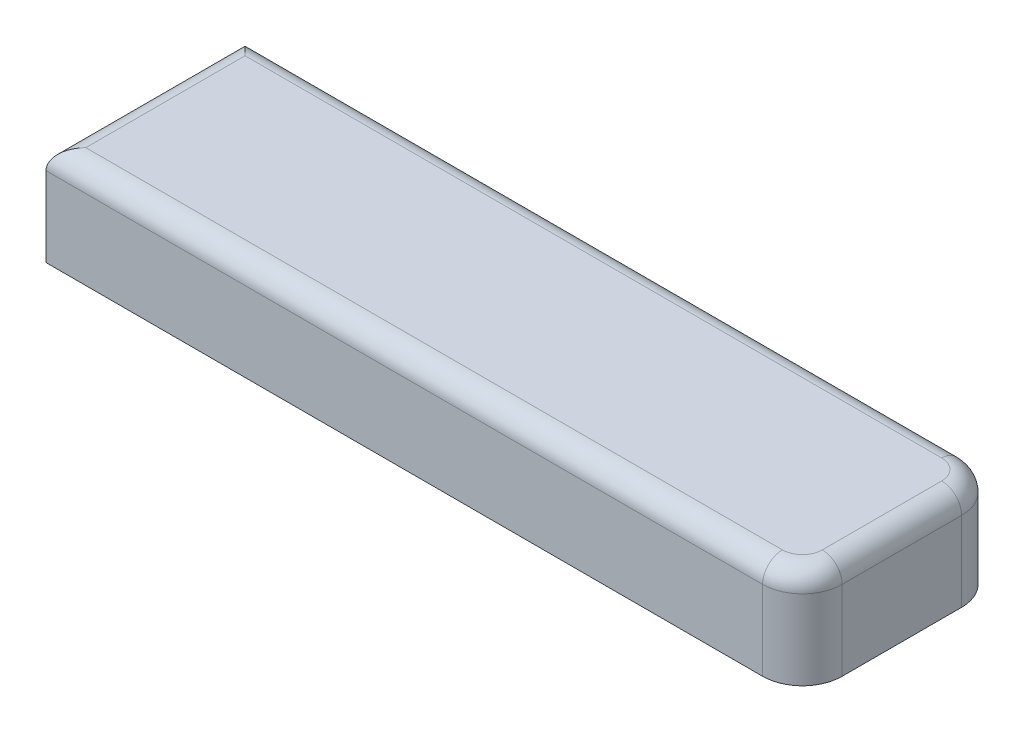
from build123d import *

# Parameters (mm, degrees)
SCHIZZO1_W                   = 38
SCHIZZO1_H                   = 5
ESTRUSIONE_ESTRUSIONE1_DEPTH = 10
RACCORDO1_R                  = 1
RACCORDO2_R                  = 2


with BuildPart() as part:
    # Schizzo1 → Estrusione-Estrusione1 (new body)
    with BuildSketch(Plane.XY):
        with Locations((19, -2.5)):
            Rectangle(SCHIZZO1_W, SCHIZZO1_H)
    extrude(amount=ESTRUSIONE_ESTRUSIONE1_DEPTH)

    # Raccordo1
    raccordo1_edges = [part.edges().sort_by_distance(p)[0] for p in [
        (19, 0, 10),
        (19, 0, 0),
        (0, 0, 5),
        (38, 0, 5),
    ]]
    fillet(raccordo1_edges, radius=RACCORDO1_R)

    # Raccordo2
    # the kernel refuses this fillet: 2 mm, written as the material it takes off along each edge
    with BuildSketch(Plane(origin=(36, 0, 8), x_dir=(0, 0, 1), z_dir=(-1, 0, 0))) as raccordo2_piece_1:
        with BuildLine():
            CenterArc((1, -1), 1, 0, 90)
            Line((2, -1), (2, 0))
            Line((2, 0), (1, 0))
        make_face()
    revolve(axis=Axis((36, 0, 8), (0, 1, 0)), revolution_arc=90, mode=Mode.SUBTRACT)
    with BuildSketch(Plane(origin=(36, 0, 2), x_dir=(1, 0, 0), z_dir=(0, 0, 1))) as raccordo2_piece_2:
        with BuildLine():
            CenterArc((1, -1), 1, 0, 90)
            Line((2, -1), (2, 0))
            Line((2, 0), (1, 0))
        make_face()
    revolve(axis=Axis((36, 0, 2), (0, 1, 0)), revolution_arc=90, mode=Mode.SUBTRACT)
    with BuildSketch(Plane(origin=(38, 0, 10), x_dir=(-1, 0, 0), z_dir=(0, -1, 0)), Plane(origin=(38, 0, 0), x_dir=(0, 0, 1), z_dir=(0, -1, 0))) as raccordo2_piece_3:
        with BuildLine():
            CenterArc((RACCORDO2_R, RACCORDO2_R), RACCORDO2_R, 180, 90)
            Line((0, RACCORDO2_R), (0, 0))
            Line((0, 0), (RACCORDO2_R, 0))
        make_face()
    extrude(amount=10, mode=Mode.SUBTRACT)


solid = part.part
